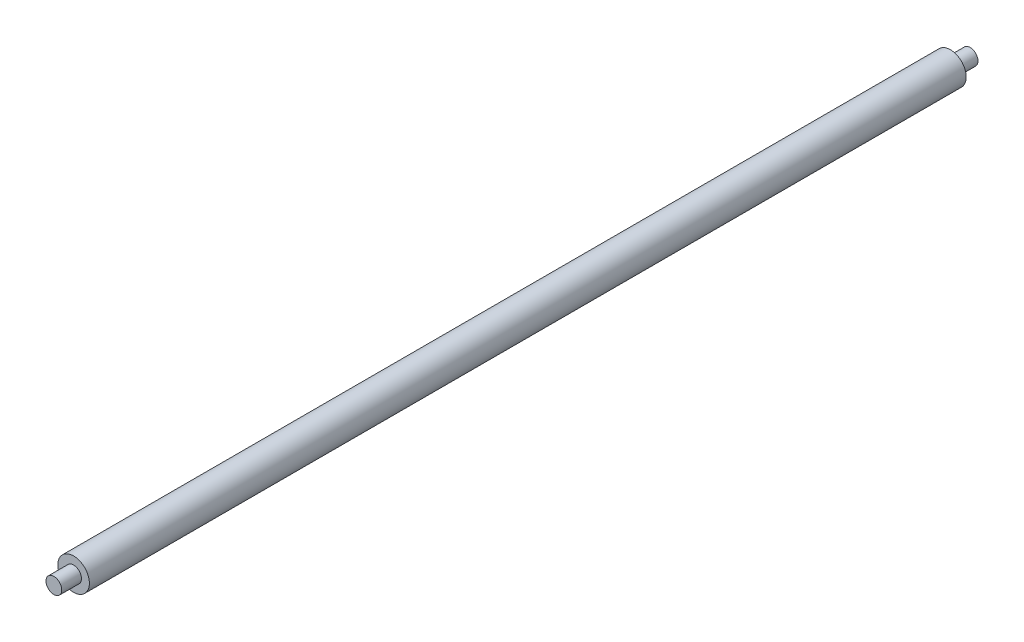
from build123d import *

# Parameters (mm, degrees)
SKETCH1_R           = 6
BOSS_EXTRUDE1_DEPTH = 166.75
SKETCH2_R           = 3
BOSS_EXTRUDE2_DEPTH = 7.5
BOSS_EXTRUDE3_START = 7.5
SKETCH3_R           = 3
BOSS_EXTRUDE3_DEPTH = 7.5


with BuildPart() as part:
    # Sketch1 → Boss-Extrude1 (new, symmetric)
    with BuildSketch(Plane.XY):
        Circle(SKETCH1_R)
    extrude(amount=BOSS_EXTRUDE1_DEPTH, both=True)

    # Sketch2 → Boss-Extrude2 (add)
    with BuildSketch(Plane.XY.offset(166.75)):
        Circle(SKETCH2_R)
    extrude(amount=BOSS_EXTRUDE2_DEPTH)

    # Sketch3 → Boss-Extrude3 (add)
    with BuildSketch(Plane(origin=(0, 0, -166.75), x_dir=(-1, 0, 0), z_dir=(0, 0, -1)).offset(BOSS_EXTRUDE3_START)):
        Circle(SKETCH3_R)
    extrude(amount=-BOSS_EXTRUDE3_DEPTH)


solid = part.part
